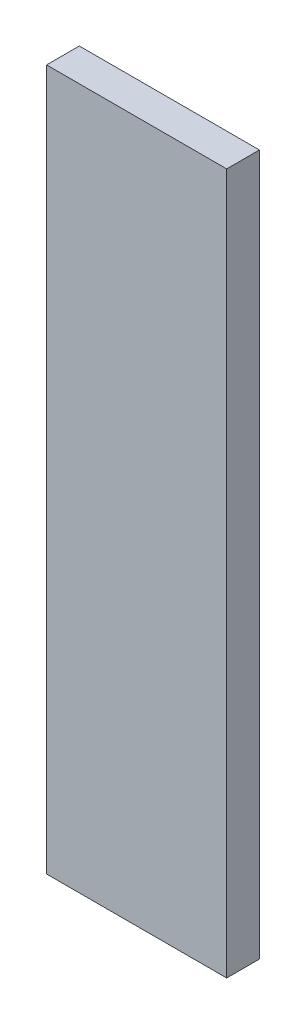
from build123d import *

# Parameters (mm, degrees)
SKETCH1_W                       = 39
SKETCH1_H                       = 155
BOSS_EXTRUDE1_DEPTH             = 2
BOSS_EXTRUDE2_DEPTH             = 58
SKETCH3_W                       = 2
SKETCH3_H                       = 2
BOSS_EXTRUDE3_DEPTH             = 58
SKETCH4_W                       = 2
SKETCH4_H                       = 2
BOSS_EXTRUDE4_DEPTH             = 151
SKETCH6_W                       = 35
SKETCH6_H                       = 2.2
CUT_EXTRUDE1_DEPTH              = 166.496978824
SKETCH7_W                       = 35
SKETCH7_H                       = 2.2
CUT_EXTRUDE2_DEPTH              = 99.744620107
SKETCH5_W                       = 31
SKETCH5_H                       = 2
BOSS_EXTRUDE5_DEPTH             = 2
BOSS_EXTRUDE6_REACH             = 101.932
SKETCH8_W                       = 2
SKETCH8_H                       = 2
BOSS_EXTRUDE6_DIRECTION_2_REACH = 101.932
SKETCH10_W                      = 2
SKETCH10_H                      = 2.2
SKETCH10_W_2                    = 2.2
SKETCH10_H_2                    = 2
BOSS_EXTRUDE8_DEPTH             = 2
SKETCH11_W                      = 2
SKETCH11_H                      = 2.2
SKETCH11_W_2                    = 2.2
SKETCH11_H_2                    = 2
BOSS_EXTRUDE9_DEPTH             = 2
FILLET2_R                       = 2.5
SKETCH14_W                      = 36.5
SKETCH14_H                      = 7.75
BOSS_EXTRUDE10_DEPTH            = 2
SKETCH13_W                      = 31
SKETCH13_H                      = 3
CUT_EXTRUDE4_DEPTH              = 2
FILLET3_R                       = 2
FILLET4_R                       = 0.5
SKETCH15_R                      = 5.1
CUT_EXTRUDE5_DEPTH              = 100.932477203
SKETCH16_R                      = 7.1
BOSS_EXTRUDE11_DEPTH            = 1
FILLET5_R                       = 0.5
FILLET7_R                       = 0.5
CUT_EXTRUDE6_DEPTH              = 100.932477263
CUT_EXTRUDE6_DEPTH_BACK         = 100.932477263
SKETCH18_W                      = 9
SKETCH18_H                      = 51
CUT_EXTRUDE7_DEPTH              = 100.078251902
CUT_EXTRUDE8_DEPTH              = 61.284741021
CUT_EXTRUDE8_DEPTH_BACK         = 61.284741021
SKETCH19_W                      = 11
SKETCH19_H                      = 8.2


with BuildPart() as part:
    # Sketch1 → Boss-Extrude1 (new body)
    with BuildSketch(Plane(origin=(0, 0, 0), x_dir=(1, 0, 0), z_dir=(0, 1, 0))):
        Rectangle(SKETCH1_W, SKETCH1_H)
    extrude(amount=BOSS_EXTRUDE1_DEPTH)

    # Sketch2 → Boss-Extrude2 (add)
    with BuildSketch(Plane(origin=(0, 2, 0), x_dir=(1, 0, 0), z_dir=(0, 1, 0))):
        Polygon((-17.5, -77.5), (-17.5, -75.5), (-17.5, 75.5), (17.5, 75.5), (17.5, -75.5), (17.5, -77.5), (19.5, -77.5), (19.5, 77.5), (-19.5, 77.5), (-19.5, -77.5), align=None)
    extrude(amount=BOSS_EXTRUDE2_DEPTH)

    # Sketch3 → Boss-Extrude3 (add)
    with BuildSketch(Plane(origin=(0, 2, 0), x_dir=(1, 0, 0), z_dir=(0, 1, 0))):
        with Locations((-16.5, -76.5)):
            Rectangle(SKETCH3_W, SKETCH3_H)
        with Locations((-16.5, -72.3)):
            Rectangle(SKETCH3_W, SKETCH3_H)
        with Locations((16.5, -76.5)):
            Rectangle(SKETCH3_W, SKETCH3_H)
        with Locations((16.5, -72.3)):
            Rectangle(SKETCH3_W, SKETCH3_H)
    extrude(amount=BOSS_EXTRUDE3_DEPTH)

    # Sketch4 → Boss-Extrude4 (add)
    with BuildSketch(Plane.XY.offset(-75.5)):
        with Locations((-16.5, 59)):
            Rectangle(SKETCH4_W, SKETCH4_H)
        Polygon((-15.5, 53.8), (-17.5, 51.8), (-17.5, 55.8), (-15.5, 55.8), align=None)
        Polygon((15.5, 55.8), (17.5, 55.8), (17.5, 51.8), (15.5, 53.8), align=None)
        with Locations((16.5, 59)):
            Rectangle(SKETCH4_W, SKETCH4_H)
    extrude(amount=BOSS_EXTRUDE4_DEPTH)

    # Sketch6 → Cut-Extrude1 (cut, through all)
    with BuildSketch(Plane.XY.offset(-75.5)):
        with Locations((0, 56.9)):
            Rectangle(SKETCH6_W, SKETCH6_H)
    extrude(amount=CUT_EXTRUDE1_DEPTH, mode=Mode.SUBTRACT)

    # Sketch7 → Cut-Extrude2 (cut, through all)
    with BuildSketch(Plane(origin=(0, 2, 0), x_dir=(1, 0, 0), z_dir=(0, 1, 0))):
        with Locations((0, -74.4)):
            Rectangle(SKETCH7_W, SKETCH7_H)
    extrude(amount=CUT_EXTRUDE2_DEPTH, mode=Mode.SUBTRACT)

    # Sketch5 → Boss-Extrude5 (add)
    with BuildSketch(Plane(origin=(0, 2, 0), x_dir=(1, 0, 0), z_dir=(0, 1, 0))):
        with Locations((0, -76.5)):
            Rectangle(SKETCH5_W, SKETCH5_H)
        with Locations((0, -72.3)):
            Rectangle(SKETCH5_W, SKETCH5_H)
    extrude(amount=BOSS_EXTRUDE5_DEPTH)

    # Boss-Extrude6: up to this face of the body (flat: up to its plane)
    boss_extrude6_end = Plane(part.part.faces().sort_by_distance((17.5, 26.9, -2.1))[0])
    # Sketch8 → Boss-Extrude6 (add, up to the picked face)
    with BuildSketch(Plane(origin=(0, 0, 0), x_dir=(0, 0, -1), z_dir=(1, 0, 0)), mode=Mode.PRIVATE) as boss_extrude6_sk1:
        with Locations((74.5, 59)):
            Rectangle(SKETCH8_W, SKETCH8_H)
    boss_extrude6_tool1 = split(extrude(boss_extrude6_sk1.sketch, amount=BOSS_EXTRUDE6_REACH, mode=Mode.PRIVATE), bisect_by=boss_extrude6_end, keep=Keep.BOTH, mode=Mode.PRIVATE)
    # Sketch8 → Boss-Extrude6 (add, up to the picked face)
    with BuildSketch(Plane(origin=(0, 0, 0), x_dir=(0, 0, -1), z_dir=(1, 0, 0)), mode=Mode.PRIVATE) as boss_extrude6_sk2:
        Polygon((75.5, 55.8), (73.5, 55.8), (73.5, 53.8), (75.5, 51.8), align=None)
    boss_extrude6_tool2 = split(extrude(boss_extrude6_sk2.sketch, amount=BOSS_EXTRUDE6_REACH, mode=Mode.PRIVATE), bisect_by=boss_extrude6_end, keep=Keep.BOTH, mode=Mode.PRIVATE)
    add(boss_extrude6_tool1.solids().sort_by(Axis((0, 59, -74.5), (1, 0, 0)))[0])
    add(boss_extrude6_tool2.solids().sort_by(Axis((0, 54.244444, -74.611111), (1, 0, 0)))[0])

    # Boss-Extrude6 direction 2: up to this face of the body (flat: up to its plane)
    boss_extrude6_direction_2_end = Plane(part.part.faces().sort_by_distance((-17.5, 26.9, -2.1))[0])
    # Sketch8 → Boss-Extrude6 direction 2 (add, up to the picked face)
    with BuildSketch(Plane(origin=(0, 0, 0), x_dir=(0, 0, -1), z_dir=(1, 0, 0)), mode=Mode.PRIVATE) as boss_extrude6_direction_2_sk1:
        with Locations((74.5, 59)):
            Rectangle(SKETCH8_W, SKETCH8_H)
    boss_extrude6_direction_2_tool1 = split(extrude(boss_extrude6_direction_2_sk1.sketch, amount=-BOSS_EXTRUDE6_DIRECTION_2_REACH, mode=Mode.PRIVATE), bisect_by=boss_extrude6_direction_2_end, keep=Keep.BOTH, mode=Mode.PRIVATE)
    # Sketch8 → Boss-Extrude6 direction 2 (add, up to the picked face)
    with BuildSketch(Plane(origin=(0, 0, 0), x_dir=(0, 0, -1), z_dir=(1, 0, 0)), mode=Mode.PRIVATE) as boss_extrude6_direction_2_sk2:
        Polygon((75.5, 55.8), (73.5, 55.8), (73.5, 53.8), (75.5, 51.8), align=None)
    boss_extrude6_direction_2_tool2 = split(extrude(boss_extrude6_direction_2_sk2.sketch, amount=-BOSS_EXTRUDE6_DIRECTION_2_REACH, mode=Mode.PRIVATE), bisect_by=boss_extrude6_direction_2_end, keep=Keep.BOTH, mode=Mode.PRIVATE)
    add(boss_extrude6_direction_2_tool1.solids().sort_by(Axis((0, 59, -74.5), (-1, 0, 0)))[0])
    add(boss_extrude6_direction_2_tool2.solids().sort_by(Axis((0, 54.244444, -74.611111), (-1, 0, 0)))[0])

    # Sketch10 → Boss-Extrude8 (add)
    with BuildSketch(Plane(origin=(-17.5, 0, 0), x_dir=(0, 0, -1), z_dir=(1, 0, 0))):
        with Locations((-76.5, 56.9)):
            Rectangle(SKETCH10_W, SKETCH10_H)
        with Locations((-74.4, 59)):
            Rectangle(SKETCH10_W_2, SKETCH10_H_2)
    extrude(amount=BOSS_EXTRUDE8_DEPTH)

    # Sketch11 → Boss-Extrude9 (add)
    with BuildSketch(Plane.ZY.offset(-17.5)):
        with Locations((76.5, 56.9)):
            Rectangle(SKETCH11_W, SKETCH11_H)
        with Locations((74.4, 59)):
            Rectangle(SKETCH11_W_2, SKETCH11_H_2)
    extrude(amount=BOSS_EXTRUDE9_DEPTH)

    # Fillet2
    fillet2_edges = [part.edges().sort_by_distance(p)[0] for p in [
        (-17.5, 26.9, 71.3),
        (17.5, 26.9, 71.3),
        (19.5, 30, 77.5),
        (-19.5, 30, 77.5),
        (-19.5, 30, -77.5),
        (-17.5, 26.9, -75.5),
        (17.5, 26.9, -75.5),
        (19.5, 30, -77.5),
        (19.5, 60, 0),
        (-19.5, 60, 0),
        (19.5, 0, 0),
        (-19.5, 0, 0),
        (0, 60, -77.5),
        (0, 0, 77.5),
        (0, 0, -77.5),
        (-17.5, 60, 77.5),
        (17.5, 60, 77.5),
    ]]
    fillet(fillet2_edges, radius=FILLET2_R)

    # Sketch14 → Boss-Extrude10 (add)
    with BuildSketch(Plane.XY.offset(-75.5)):
        with Locations((0, 5.125)):
            Rectangle(SKETCH14_W, SKETCH14_H)
    extrude(amount=BOSS_EXTRUDE10_DEPTH)

    # Sketch13 → Cut-Extrude4 (cut)
    with BuildSketch(Plane(origin=(0, 0, -77.5), x_dir=(-1, 0, 0), z_dir=(0, 0, -1))):
        with Locations((0, 5.5)):
            Rectangle(SKETCH13_W, SKETCH13_H)
    extrude(amount=-CUT_EXTRUDE4_DEPTH, mode=Mode.SUBTRACT)

    # Fillet3
    fillet3_edges = [part.edges().sort_by_distance(p)[0] for p in [
        (0, 9, -73.5),
    ]]
    fillet(fillet3_edges, radius=FILLET3_R - 0.0001)  # a hair under: the kernel refuses the full size

    # Fillet4
    fillet4_edges = [part.edges().sort_by_distance(p)[0] for p in [
        (15.5, 5.5, -75.5),
        (15.5, 4, -76.5),
        (0, 7, -75.5),
        (15.5, 7, -76.5),
        (-15.5, 5.5, -75.5),
        (-15.5, 7, -76.5),
        (0, 4, -75.5),
        (-15.5, 4, -76.5),
        (15.5, 5.5, -77.5),
        (0, 4, -77.5),
        (-15.5, 5.5, -77.5),
        (0, 7, -77.5),
    ]]
    fillet(fillet4_edges, radius=FILLET4_R)

    # Sketch15 → Cut-Extrude5 (cut, through all)
    with BuildSketch(Plane.XZ):
        with Locations(Location((0, 38.75, 0), (0, 0, 270))):
            Circle(SKETCH15_R)
        with Locations(Location((0, -38.75, 0), (0, 0, 270))):
            Circle(SKETCH15_R)
    extrude(amount=-CUT_EXTRUDE5_DEPTH, mode=Mode.SUBTRACT)

    # Sketch16 → Boss-Extrude11 (add)
    with BuildSketch(Plane(origin=(0, 2, 0), x_dir=(1, 0, 0), z_dir=(0, 1, 0))):
        with Locations(Location((0, 38.75, 0), (0, 0, 270))):
            Circle(SKETCH16_R)
        with Locations(Location((0, -38.75, 0), (0, 0, 270))):
            Circle(SKETCH16_R)
    extrude(amount=BOSS_EXTRUDE11_DEPTH)

    # Fillet5
    fillet5_edges = [part.edges().sort_by_distance(p)[0] for p in [
        (0, 2, -45.85),
        (0, 3, -45.85),
        (0, 2, 31.65),
        (0, 3, 31.65),
    ]]
    fillet(fillet5_edges, radius=FILLET5_R - 0.0001)  # a hair under: the kernel refuses the full size

    # Fillet7
    fillet7_edges = [part.edges().sort_by_distance(p)[0] for p in [
        (15.5, 60, 0.75),
        (0, 4, 77.5),
        (0, 60, -73.5),
        (-15.5, 60, 0.75),
        (-15.5, 30.75, 77.5),
        (-15.5, 59.267766953, 76.767766953),
        (15.5, 30.75, 77.5),
        (15.5, 59.267766953, 76.767766953),
    ]]
    fillet(fillet7_edges, radius=FILLET7_R)

    # Sketch17 → Cut-Extrude6 (cut, two sides: drawn at the far end of the back side and taken through both)
    with BuildSketch(Plane.XY.offset(-CUT_EXTRUDE6_DEPTH_BACK)):
        Polygon((19.5, 60), (14.5, 60), (14.5, 9), (0, 9), (0, 0), (19.5, 0), align=None)
        Polygon((-14.5, 60), (-19.5, 60), (-19.5, 0), (0, 0), (0, 9), (-14.5, 9), align=None)
    extrude(amount=CUT_EXTRUDE6_DEPTH + CUT_EXTRUDE6_DEPTH_BACK, mode=Mode.SUBTRACT)

    # Sketch18 → Cut-Extrude7 (cut, through all)
    with BuildSketch(Plane.XY):
        with Locations((-10, 34.5)):
            Rectangle(SKETCH18_W, SKETCH18_H)
        with Locations((10, 34.5)):
            Rectangle(SKETCH18_W, SKETCH18_H)
    extrude(amount=-CUT_EXTRUDE7_DEPTH, mode=Mode.SUBTRACT)

    # Sketch19 → Cut-Extrude8 (cut, two sides: drawn at the far end of the back side and taken through both)
    with BuildSketch(Plane.XY.offset(-75.5).offset(-CUT_EXTRUDE8_DEPTH_BACK)):
        with Locations((0, 55.9)):
            Rectangle(SKETCH19_W, SKETCH19_H)
    extrude(amount=CUT_EXTRUDE8_DEPTH + CUT_EXTRUDE8_DEPTH_BACK, mode=Mode.SUBTRACT)


solid = part.part
